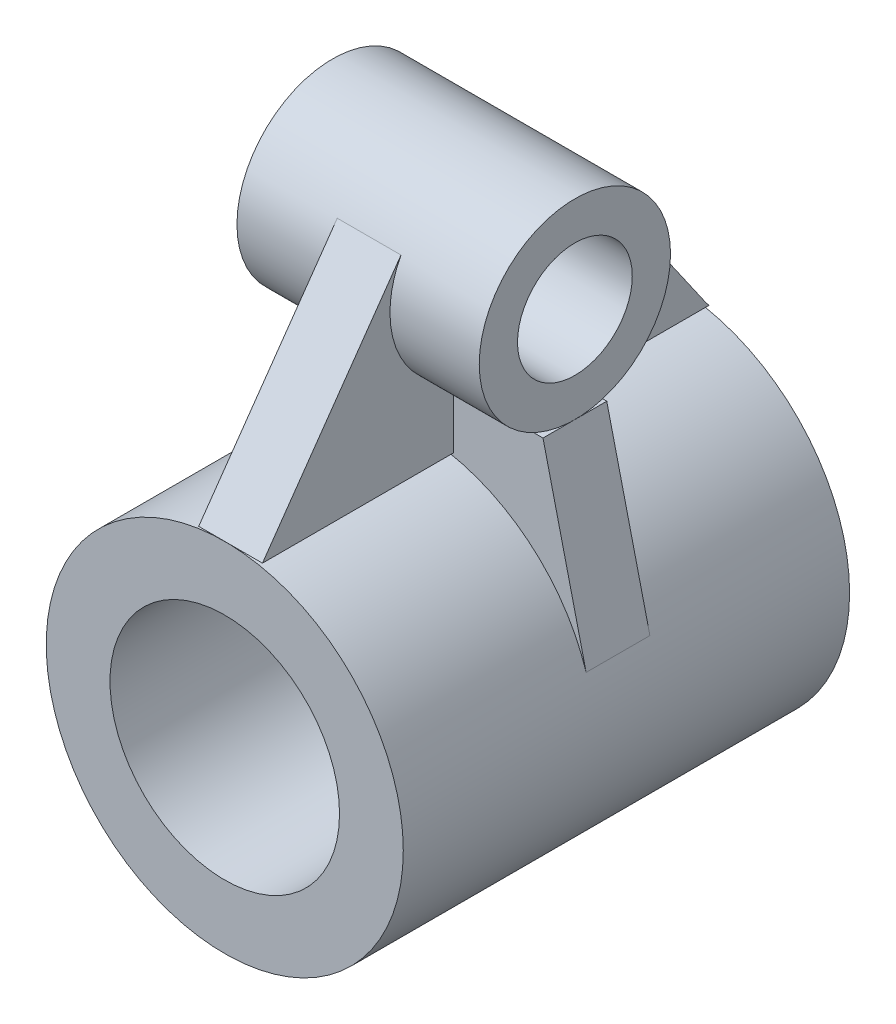
from build123d import *
from build123d.topology import SkipClean

# Parameters (mm, degrees)
SKETCH1_R            = 14
SKETCH1_R_2          = 9
BOSS_EXTRUDE1_DEPTH  = 35
SKETCH4_W            = 5
SKETCH4_H            = 35
BOSS_EXTRUDE4_DEPTH  = 12
SKETCH5_R            = 4.5
BOSS_EXTRUDE5_DEPTH  = 5
CUT_EXTRUDE1_DEPTH   = 5
SKETCH7_R            = 7.5
SKETCH7_R_2          = 4.5
BOSS_EXTRUDE6_DEPTH  = 7
SKETCH8_R            = 7.5
SKETCH8_R_2          = 4.5
BOSS_EXTRUDE7_DEPTH  = 7
CUT_EXTRUDE2_DEPTH   = 7
BOSS_EXTRUDE8_DEPTH  = 5
BOSS_EXTRUDE9_DEPTH  = 5
BOSS_EXTRUDE12_DEPTH = 2.5


with BuildPart() as part:
    # Sketch1 → Boss-Extrude1 (new body)
    with BuildSketch(Plane.XY):
        Circle(SKETCH1_R)
        Circle(SKETCH1_R_2, mode=Mode.SUBTRACT)
    extrude(amount=-BOSS_EXTRUDE1_DEPTH)

    # Sketch12 → Boss-Extrude12 (add, symmetric)
    with BuildSketch(Plane.XY.offset(-17.5)):
        with BuildLine():
            Line((-0.818332467, 18.5), (-9.043627642, 18.5))
            Line((-9.043627642, 18.5), (-12.947623307, 5.220100328))
            ThreePointArc((-12.947623307, 5.220100328), (-8.123226822, 11.323434212), (-0.818332467, 14))
            Line((-0.818332467, 14), (-0.818332467, 18.5))
        make_face()
        with BuildLine():
            Line((13.338811552, 4.272276348), (9.956372358, 18.5))
            Line((9.956372358, 18.5), (1.363887445, 18.5))
            Line((1.363887445, 18.5), (1.363887445, 14))
            ThreePointArc((1.363887445, 14), (8.807656249, 10.928866199), (13.338811552, 4.272276348))
        make_face()
    extrude(amount=BOSS_EXTRUDE12_DEPTH, both=True)


with BuildPart() as body_2:
    # Sketch4 → Boss-Extrude4 (new body)
    with BuildSketch(Plane(origin=(0, 14, 0), x_dir=(1, 0, 0), z_dir=(0, 1, 0))):
        with Locations((0.456372358, 17.5)):
            Rectangle(SKETCH4_W, SKETCH4_H)
    extrude(amount=BOSS_EXTRUDE4_DEPTH)

    # Sketch5 → Boss-Extrude5 (add)
    with BuildSketch(Plane.ZY.offset(2.043627642)):
        with BuildLine():
            Line((-25, 26), (-35, 14))
            Line((-35, 14), (0, 14))
            Line((0, 14), (-10, 26))
            ThreePointArc((-10, 26), (-17.5, 33.5), (-25, 26))
        make_face()
        with Locations((-17.5, 26)):
            Circle(SKETCH5_R, mode=Mode.SUBTRACT)
    extrude(amount=-BOSS_EXTRUDE5_DEPTH)

    # Sketch6 → Cut-Extrude1 (cut)
    with BuildSketch(Plane.ZY.offset(2.043627642)):
        Polygon((-10, 26), (0, 14), (0, 26), align=None)
        Polygon((-35, 14.02874747), (-25, 26), (-35, 26), align=None)
    extrude(amount=-CUT_EXTRUDE1_DEPTH, mode=Mode.SUBTRACT)

    # Sketch7 → Boss-Extrude6 (add)
    with BuildSketch(Plane.ZY.offset(2.043627642)):
        with Locations((-17.5, 26)):
            Circle(SKETCH7_R)
        with Locations((-17.5, 26)):
            Circle(SKETCH7_R_2, mode=Mode.SUBTRACT)
    extrude(amount=BOSS_EXTRUDE6_DEPTH)

    # Sketch8 → Boss-Extrude7 (add)
    with SkipClean():  # the faces are left unmerged after this step: merging them gives an invalid solid
        with BuildSketch(Plane(origin=(2.956372358, 0, 0), x_dir=(0, 0, -1), z_dir=(1, 0, 0))):
            with Locations((17.5, 26)):
                Circle(SKETCH8_R)
            with Locations((17.5, 26)):
                Circle(SKETCH8_R_2, mode=Mode.SUBTRACT)
        extrude(amount=BOSS_EXTRUDE7_DEPTH)

    # Sketch9 → Cut-Extrude2 (cut)
    with SkipClean():  # the faces are left unmerged after this step: merging them gives an invalid solid
        with BuildSketch(Plane.ZY.offset(2.043627642)):
            with BuildLine():
                Line((-22, 26), (-13, 26))
                ThreePointArc((-13, 26), (-17.5, 21.5), (-22, 26))
            make_face()
        extrude(amount=-CUT_EXTRUDE2_DEPTH, mode=Mode.SUBTRACT)


with BuildPart() as boss_extrude8_tool:
    # Sketch10 → Boss-Extrude8 (new body)
    with SkipClean():  # the faces are left unmerged after this step: merging them gives an invalid solid
        with BuildSketch(Plane.ZY.offset(2.043627642)):
            with BuildLine():
                Line((-34.987881967, 14), (-23.65611892, 30.283946761))
                ThreePointArc((-23.65611892, 30.283946761), (-24.656148307, 28.244895386), (-25, 26))
                Line((-25, 26), (-34.987881967, 14))
            make_face()
        extrude(amount=-BOSS_EXTRUDE8_DEPTH)


with BuildPart() as body_2_1:
    with SkipClean():  # the faces are left unmerged after this step: merging them gives an invalid solid
        add(body_2.part)


with BuildPart() as body_2_2:
    # Boss-Extrude8: joined with boss_extrude8_tool
    with SkipClean():  # the faces are left unmerged after this step: merging them gives an invalid solid
        add(body_2_1.part.fuse(boss_extrude8_tool.part, tol=0.00001))

    # Sketch11 → Boss-Extrude9 (add)
    with SkipClean():  # the faces are left unmerged after this step: merging them gives an invalid solid
        with BuildSketch(Plane.ZY.offset(2.043627642)):
            with BuildLine():
                Line((0, 14), (-10.863909081, 29.494609752))
                ThreePointArc((-10.863909081, 29.494609752), (-10.219179926, 27.799905291), (-10, 26))
                Line((-10, 26), (0, 14))
            make_face()
        extrude(amount=-BOSS_EXTRUDE9_DEPTH)


with BuildPart() as boss_extrude12_piece_1:
    # of the separate pieces the step leaves, piece 1, a body of its own (boss_extrude12_pieces)
    add(part.part.solids().sort_by_distance((14, 0, 0))[0])


with BuildPart() as boss_extrude12_piece_2:
    # of the separate pieces the step leaves, piece 2, a body of its own (boss_extrude12_pieces)
    add(part.part.solids().sort_by_distance((13.338811552, 4.272276348, -20))[0])


solid = Compound([body_2_2.part, boss_extrude12_piece_1.part, boss_extrude12_piece_2.part])
